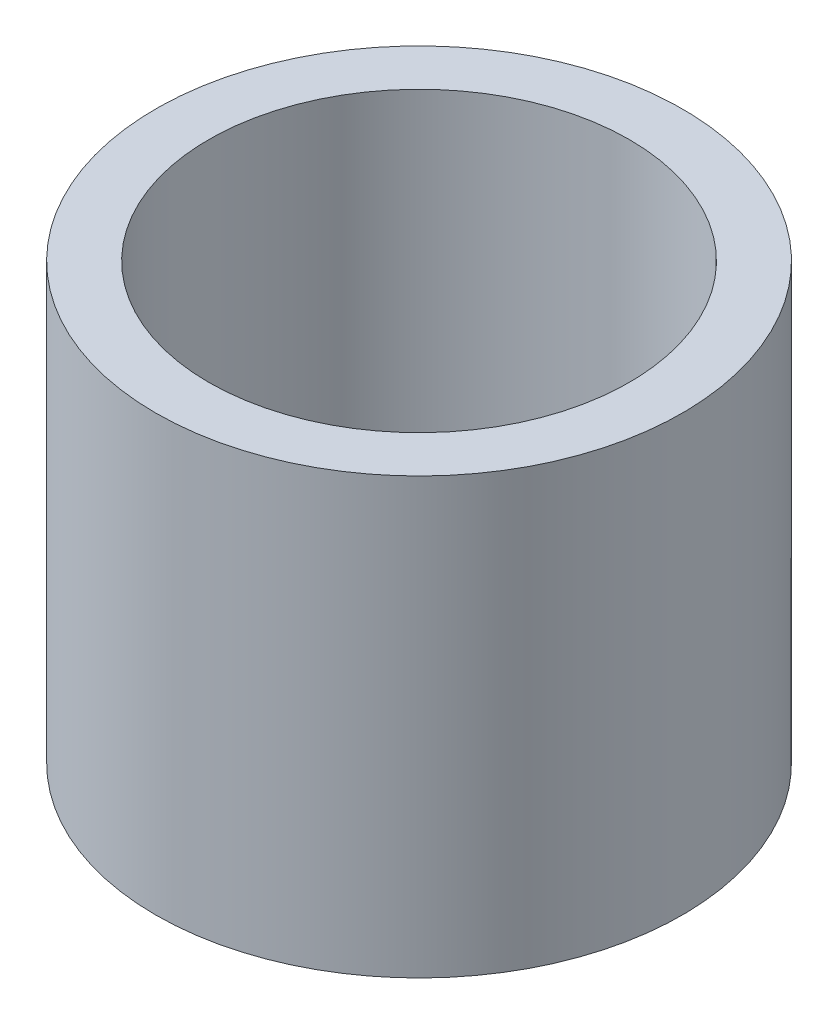
from build123d import *

# Parameters (mm, degrees)
SKETCH1_R           = 22.5
BOSS_EXTRUDE1_DEPTH = 37.139989047
SKETCH2_R           = 17.967443805
CUT_EXTRUDE1_DEPTH  = 49.906837829


with BuildPart() as part:
    # Sketch1 → Boss-Extrude1 (new body)
    with BuildSketch(Plane(origin=(0, 0, 0), x_dir=(1, 0, 0), z_dir=(0, 1, 0))):
        Circle(SKETCH1_R)
    extrude(amount=BOSS_EXTRUDE1_DEPTH)

    # Sketch2 → Cut-Extrude1 (cut, through all)
    with BuildSketch(Plane(origin=(0, 0, 0), x_dir=(1, 0, 0), z_dir=(0, 1, 0))):
        Circle(SKETCH2_R)
    extrude(amount=CUT_EXTRUDE1_DEPTH, mode=Mode.SUBTRACT)


solid = part.part
